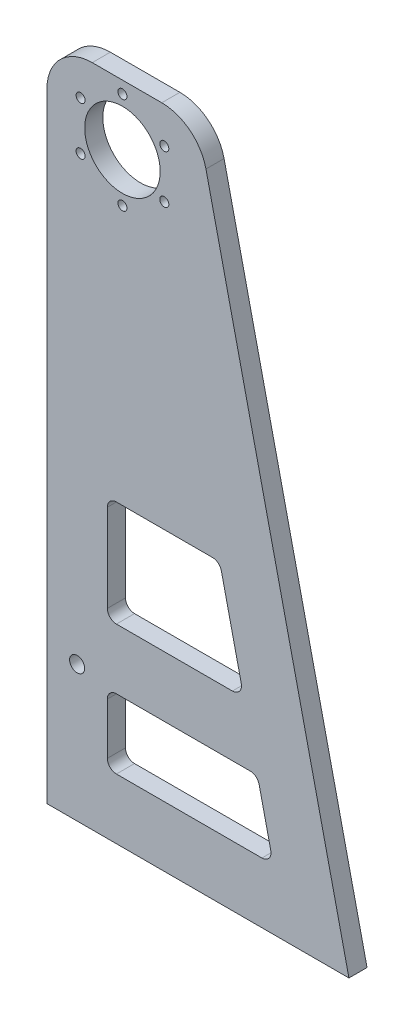
from build123d import *

# Parameters (mm, degrees)
ESBO_O1_R                = 12.5
ESBO_O1_R_2              = 1.5
ESBO_O1_R_3              = 2.5
RESSALTO_EXTRUS_O2_DEPTH = 6
FILETE1_R                = 15


with BuildPart() as part:
    # Esboço1 → Ressalto-extrusão2 (new body)
    with BuildSketch(Plane.XY):
        Polygon((0, 0), (0, 220), (50, 220), (100, 0), align=None)
        with Locations((25, 200)):
            Circle(ESBO_O1_R, mode=Mode.SUBTRACT)
        with Locations((25, 216)):
            Circle(ESBO_O1_R_2, mode=Mode.SUBTRACT)
        with Locations((38.856406461, 208)):
            Circle(ESBO_O1_R_2, mode=Mode.SUBTRACT)
        with Locations((38.856406461, 192)):
            Circle(ESBO_O1_R_2, mode=Mode.SUBTRACT)
        with Locations((25, 184)):
            Circle(ESBO_O1_R_2, mode=Mode.SUBTRACT)
        with Locations((11.143593539, 192)):
            Circle(ESBO_O1_R_2, mode=Mode.SUBTRACT)
        with Locations((11.143593539, 208)):
            Circle(ESBO_O1_R_2, mode=Mode.SUBTRACT)
        with Locations((10, 45)):
            Circle(ESBO_O1_R_3, mode=Mode.SUBTRACT)
        with BuildLine():
            Line((20, 95), (20, 66))
            ThreePointArc((20, 66), (20.878679656, 63.878679656), (23, 63))
            Line((23, 63), (61.413470366, 63))
            ThreePointArc((61.413470366, 63), (63.75810146, 64.128448496), (64.338868934, 66.664863311))
            Line((64.338868934, 66.664863311), (57.747959843, 95.664863311))
            ThreePointArc((57.747959843, 95.664863311), (56.69411278, 97.344631094), (54.822561275, 98))
            Line((54.822561275, 98), (23, 98))
            ThreePointArc((23, 98), (20.878679656, 97.121320344), (20, 95))
        make_face(mode=Mode.SUBTRACT)
        with BuildLine():
            Line((20, 40), (20, 23))
            ThreePointArc((20, 23), (20.878679656, 20.878679656), (23, 20))
            Line((23, 20), (71.186197639, 20))
            ThreePointArc((71.186197639, 20), (73.530828733, 21.128448496), (74.111596206, 23.664863311))
            Line((74.111596206, 23.664863311), (70.247959843, 40.664863311))
            ThreePointArc((70.247959843, 40.664863311), (69.19411278, 42.344631094), (67.322561275, 43))
            Line((67.322561275, 43), (23, 43))
            ThreePointArc((23, 43), (20.878679656, 42.121320344), (20, 40))
        make_face(mode=Mode.SUBTRACT)
    extrude(amount=RESSALTO_EXTRUS_O2_DEPTH)

    # Filete1
    filete1_edges = [part.edges().sort_by_distance(p)[0] for p in [
        (0, 220, 3),
        (50, 220, 3),
    ]]
    fillet(filete1_edges, radius=FILETE1_R)


solid = part.part
